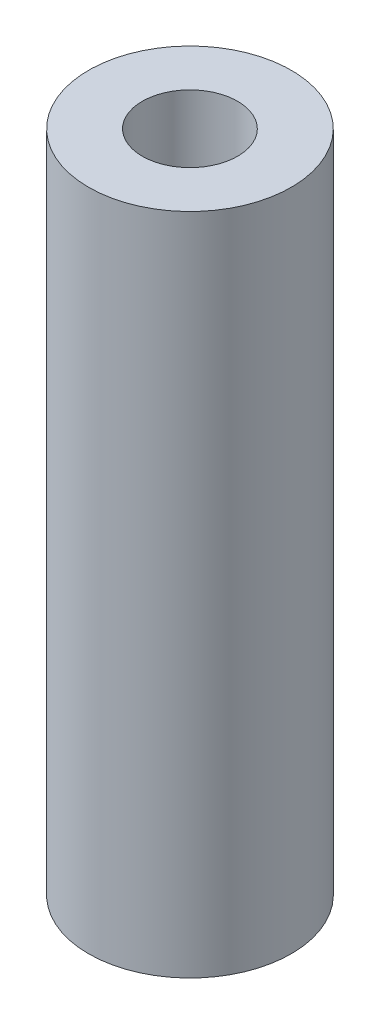
from build123d import *

# Parameters (mm, degrees)
SKETCH1_R           = 5.955
BOSS_EXTRUDE1_DEPTH = 39
SKETCH2_R           = 2.8
CUT_EXTRUDE1_DEPTH  = 4.5


with BuildPart() as part:
    # Sketch1 → Boss-Extrude1 (new body)
    with BuildSketch(Plane(origin=(0, 0, 0), x_dir=(1, 0, 0), z_dir=(0, 1, 0))):
        Circle(SKETCH1_R)
    extrude(amount=BOSS_EXTRUDE1_DEPTH)

    # Sketch2 → Cut-Extrude1 (cut)
    with BuildSketch(Plane(origin=(0, 39, 0), x_dir=(1, 0, 0), z_dir=(0, 1, 0))):
        Circle(SKETCH2_R)
    extrude(amount=-CUT_EXTRUDE1_DEPTH, mode=Mode.SUBTRACT)


solid = part.part
